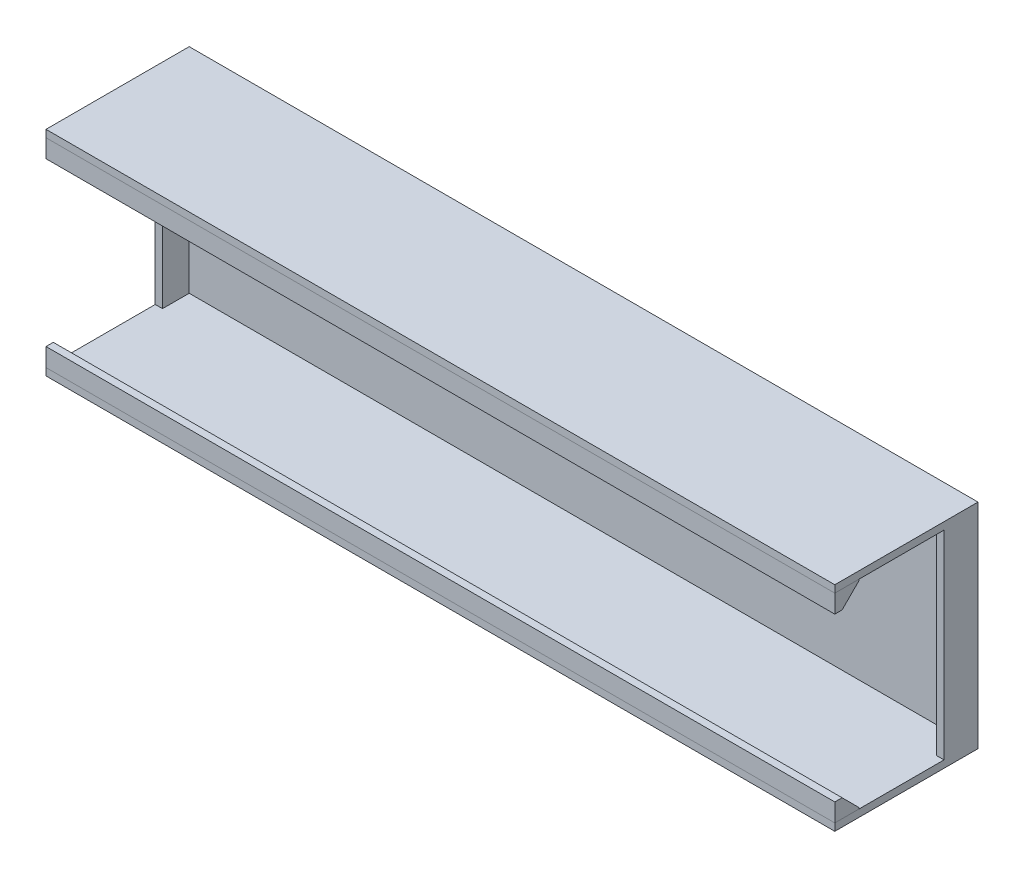
from build123d import *

# Parameters (mm, degrees)
SKETCH1_W             = 65
SKETCH1_H             = 17.6
BOSS_EXTRUDE1_DEPTH   = 11.8
SHELL1_T              = -0.6
SKETCH2_W             = 9
SKETCH2_H             = 16.4
CUT_EXTRUDE1_DEPTH    = 67.645930108
SKETCH3_W             = 65
SKETCH3_H             = 1.5
BOSS_EXTRUDE2_DEPTH   = 2
BOSS_EXTRUDE2_2_DEPTH = 2
CHAMFER1_SIZE         = 1.4
CHAMFER2_SIZE         = 1.4
SKETCH4_R             = 2.75
CUT_EXTRUDE2_DEPTH    = 3
FILLET2_R             = 2


with BuildPart() as part:
    # Sketch1 → Boss-Extrude1 (new body)
    with BuildSketch(Plane.XY):
        Rectangle(SKETCH1_W, SKETCH1_H)
    extrude(amount=BOSS_EXTRUDE1_DEPTH)

    # Shell1
    shell1_openings = [part.faces().sort_by_distance(p)[0] for p in [
        (0, 0, 11.8),
    ]]
    offset(amount=SHELL1_T, openings=shell1_openings, kind=Kind.INTERSECTION)

    # Sketch2 → Cut-Extrude1 (cut, through all)
    with BuildSketch(Plane.ZY.offset(32.5)):
        with Locations((7.3, 0)):
            Rectangle(SKETCH2_W, SKETCH2_H)
    extrude(amount=-CUT_EXTRUDE1_DEPTH, mode=Mode.SUBTRACT)

    # Sketch4 → Cut-Extrude2 (cut)
    with BuildSketch(Plane(origin=(0, 0, 0), x_dir=(-1, 0, 0), z_dir=(0, 0, -1))):
        with Locations((-10, 0)):
            Circle(SKETCH4_R)
        with Locations(Location((10, 0, 0), (0, 0, 180))):
            Circle(SKETCH4_R)
    extrude(amount=-CUT_EXTRUDE2_DEPTH, mode=Mode.SUBTRACT)

    # Fillet2
    # the kernel refuses this fillet: 2 mm, written as the material it takes off along each edge
    with BuildSketch(Plane(origin=(10, 0, 0.6), x_dir=(-1, 0, 0), z_dir=(0, -1, 0))) as fillet2_piece_1:
        with BuildLine():
            CenterArc((4.178285686, 2), FILLET2_R, 224.427004001, 45.572995999)
            Line((4.178285686, 0), (4.178285686, -0.04))
            Line((4.178285686, -0.04), (2.75, -0.04))
            Line((2.75, -0.04), (2.71, 0))
            ThreePointArc((2.71, 0), (2.71, 0.3), (2.721434286, 0.572))
            Line((2.721434286, 0.572), (2.75, 0.6))
        make_face()
    revolve(axis=Axis((10, 0, 0.6), (0, 0, -1)), mode=Mode.SUBTRACT)
    with BuildSketch(Plane(origin=(-10, 0, 0.6), x_dir=(1, 0, 0), z_dir=(0, 1, 0))) as fillet2_piece_2:
        with BuildLine():
            CenterArc((4.178285686, 2), FILLET2_R, 224.427004001, 45.572995999)
            Line((4.178285686, 0), (4.178285686, -0.04))
            Line((4.178285686, -0.04), (2.75, -0.04))
            Line((2.75, -0.04), (2.71, 0))
            ThreePointArc((2.71, 0), (2.71, 0.3), (2.721434286, 0.572))
            Line((2.721434286, 0.572), (2.75, 0.6))
        make_face()
    revolve(axis=Axis((-10, 0, 0.6), (0, 0, -1)), mode=Mode.SUBTRACT)


with BuildPart() as body_2:
    # Sketch3 → Boss-Extrude2 (new body)
    with BuildSketch(Plane.XY.offset(11.8)):
        with Locations((0, 7.45)):
            Rectangle(SKETCH3_W, SKETCH3_H)
    extrude(amount=-BOSS_EXTRUDE2_DEPTH)

    # Chamfer1
    chamfer1_edges = [body_2.edges().sort_by_distance(p)[0] for p in [
        (0, 6.7, 9.8),
    ]]
    chamfer(chamfer1_edges, length=CHAMFER1_SIZE)


with BuildPart() as body_3:
    # Sketch3 → Boss-Extrude2 2 (new body)
    with BuildSketch(Plane.XY.offset(11.8)):
        with Locations((0, -7.45)):
            Rectangle(SKETCH3_W, SKETCH3_H)
    extrude(amount=-BOSS_EXTRUDE2_2_DEPTH)

    # Chamfer2
    chamfer2_edges = [body_3.edges().sort_by_distance(p)[0] for p in [
        (0, -6.7, 9.8),
    ]]
    chamfer(chamfer2_edges, length=CHAMFER2_SIZE)


solid = Compound([part.part, body_2.part, body_3.part])
